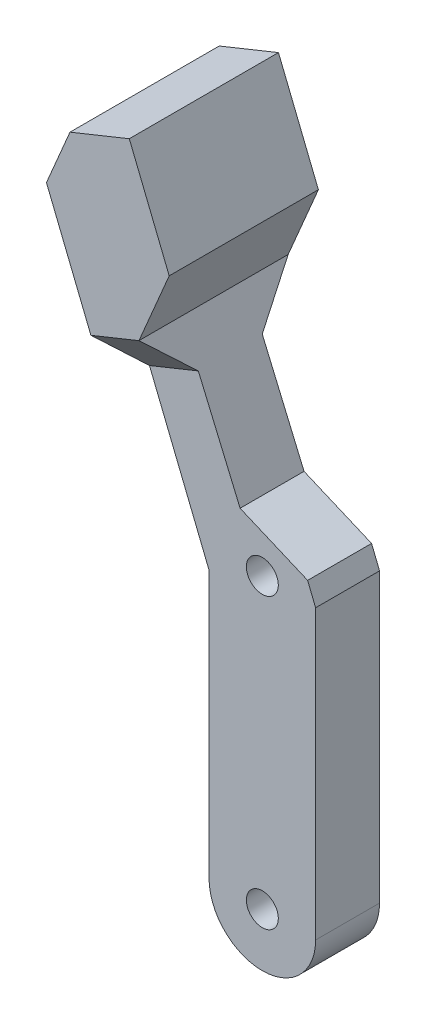
from build123d import *

# Parameters (mm, degrees)
EXTRUDE_1_DEPTH      = 6
CHAMFER_1_SIZE       = 4
SKETCH_2_R           = 1.5
CUT_EXTRUDE_1_DEPTH  = 63.816723883
EXTRUDE_2_DEPTH      = 4
EXTRUDE_2_DEPTH_BACK = 10
CHAMFER_2_SIZE       = 4


with BuildPart() as part:
    # 草图1 → 凸台-拉伸1 (new body)
    with BuildSketch(Plane.XY):
        with BuildLine():
            Line((-5, 0), (-5, 25.056196909))
            Line((-5, 25.056196909), (-17.757675909, 56.63255283))
            Line((-17.757675909, 56.63255283), (-8.485837363, 60.378618764))
            Line((-8.485837363, 60.378618764), (-4.739771429, 51.106780219))
            Line((-4.739771429, 51.106780219), (-7.577195414, 44.422228211))
            Line((-7.577195414, 44.422228211), (-2.08588611, 31.544125784))
            Line((-2.08588611, 31.544125784), (4.250786813, 28.854367709))
            Line((4.250786813, 28.854367709), (5, 27))
            Line((5, 27), (5, 0))
            ThreePointArc((5, 0), (0, -5), (-5, 0))
        make_face()
    extrude(amount=EXTRUDE_1_DEPTH)

    # 倒角1
    chamfer_1_edges = [part.edges().sort_by_distance(p)[0] for p in [
        (-17.757675909, 56.63255283, 3),
    ]]
    chamfer(chamfer_1_edges, length=CHAMFER_1_SIZE)

    # 草图2 → 切除-拉伸1 (cut, through all)
    with BuildSketch(Plane.XY.offset(6)):
        with Locations((0, 27.08857665)):
            Circle(SKETCH_2_R)
        Circle(SKETCH_2_R)
    extrude(amount=-CUT_EXTRUDE_1_DEPTH, mode=Mode.SUBTRACT)

    # 草图3 → 凸台-拉伸2 (add, two sides: drawn at the far end of the back side and taken through both)
    with BuildSketch(Plane(origin=(0, 0, 0), x_dir=(-1, 0, 0), z_dir=(0, 0, -1)).offset(-EXTRUDE_2_DEPTH_BACK)):
        Polygon((16.259249535, 52.923817412), (14.04894049, 58.130979204), (8.485837363, 60.378618764), (4.739771429, 51.106780219), (7.577195414, 44.422228211), (12.088045963, 42.599726288), align=None)
    extrude(amount=EXTRUDE_2_DEPTH + EXTRUDE_2_DEPTH_BACK)

    # 倒角2
    chamfer_2_edges = [part.edges().sort_by_distance(p)[0] for p in [
        (-9.832620688, 43.51097725, 6),
        (-9.832620688, 43.51097725, 0),
    ]]
    chamfer(chamfer_2_edges, length=CHAMFER_2_SIZE - 0.0001)  # a hair under: the kernel refuses the full size


solid = part.part
